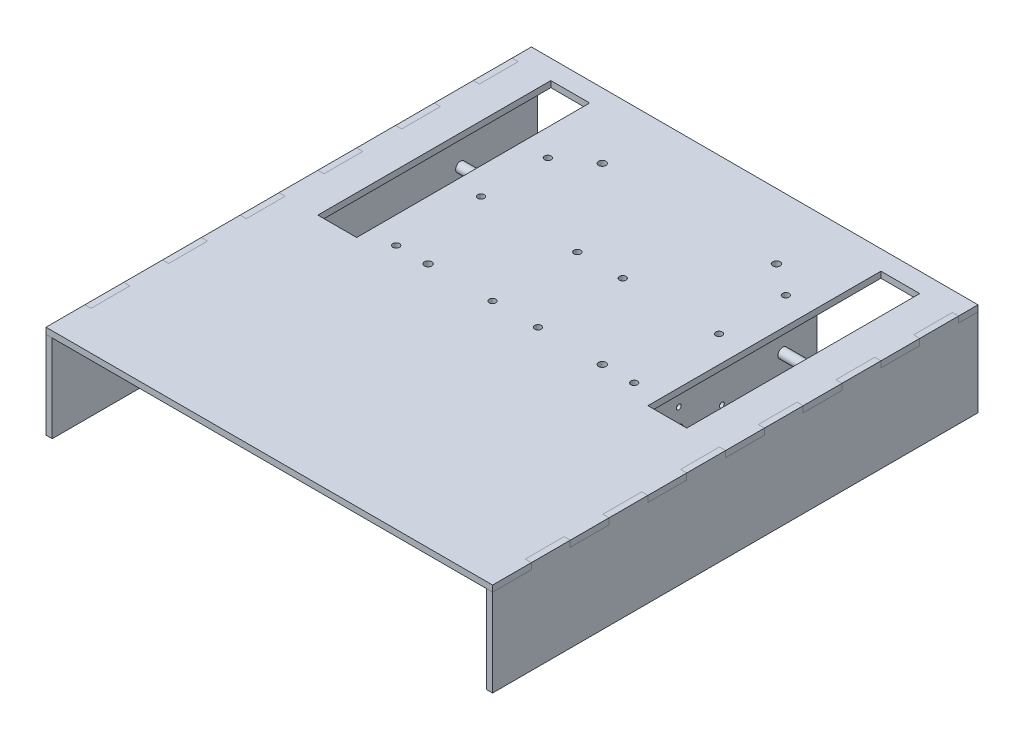
from build123d import *

# Parameters (mm, degrees)
SKETCH2_W           = 20
SKETCH2_H           = 120
BOSS_EXTRUDE1_DEPTH = 3.175
BOSS_EXTRUDE2_DEPTH = 3.175
BOSS_EXTRUDE3_DEPTH = 1.6129
SKETCH6_R           = 1.27
SKETCH6_R_2         = 2.3749
SKETCH6_R_3         = 2.55
BOSS_EXTRUDE4_DEPTH = 1.6129
SKETCH7_R           = 1.7
SKETCH7_R_2         = 1.9
CUT_EXTRUDE1_DEPTH  = 10
SKETCH9_R           = 2.5
BOSS_EXTRUDE6_DEPTH = 189


with BuildPart() as part:
    # Sketch2 → Boss-Extrude1 (new body)
    with BuildSketch(Plane(origin=(0, 0, 0), x_dir=(1, 0, 0), z_dir=(0, 1, 0))):
        Polygon((-172.266187111, -88.214102909), (57.733812889, -88.214102909), (57.733812889, -68.214102909), (54.558812889, -68.214102909), (54.558812889, -48.214102909), (57.733812889, -48.214102909), (57.733812889, -28.214102909), (54.558812889, -28.214102909), (54.558812889, -8.214102909), (57.733812889, -8.214102909), (57.733812889, 11.785897091), (54.558812889, 11.785897091), (54.558812889, 31.785897091), (57.733812889, 31.785897091), (57.733812889, 51.785897091), (54.558812889, 51.785897091), (54.558812889, 71.785897091), (57.733812889, 71.785897091), (57.733812889, 91.785897091), (54.558812889, 91.785897091), (54.558812889, 111.785897091), (57.733812889, 111.785897091), (57.733812889, 131.785897091), (54.558812889, 131.785897091), (54.558812889, 151.785897091), (57.733812889, 151.785897091), (57.733812889, 161.785897091), (-172.266187111, 161.785897091), (-172.266187111, 151.785897091), (-169.091187111, 151.785897091), (-169.091187111, 131.785897091), (-172.266187111, 131.785897091), (-172.266187111, 111.785897091), (-169.091187111, 111.785897091), (-169.091187111, 91.785897091), (-172.266187111, 91.785897091), (-172.266187111, 71.785897091), (-169.091187111, 71.785897091), (-169.091187111, 51.785897091), (-172.266187111, 51.785897091), (-172.266187111, 31.785897091), (-169.091187111, 31.785897091), (-169.091187111, 11.785897091), (-172.266187111, 11.785897091), (-172.266187111, -8.214102909), (-169.091187111, -8.214102909), (-169.091187111, -28.214102909), (-172.266187111, -28.214102909), (-172.266187111, -48.214102909), (-169.091187111, -48.214102909), (-169.091187111, -68.214102909), (-172.266187111, -68.214102909), align=None)
        with Locations((27.733812889, 91.785897091)):
            Rectangle(SKETCH2_W, SKETCH2_H, mode=Mode.SUBTRACT)
        with Locations((-142.266187111, 91.785897091)):
            Rectangle(SKETCH2_W, SKETCH2_H, mode=Mode.SUBTRACT)
    extrude(amount=BOSS_EXTRUDE1_DEPTH)


with BuildPart() as body_2:
    # Sketch3 → Boss-Extrude2 (new body)
    with BuildSketch(Plane.ZY.offset(169.091187111)):
        Polygon((68.214102909, 3.175), (68.214102909, 0), (88.214102909, 0), (88.214102909, -45), (-161.732040232, -45), (-161.732040232, 0), (-151.785897091, 0), (-151.785897091, 3.175), (-131.785897091, 3.175), (-131.785897091, 0), (-111.785897091, 0), (-111.785897091, 3.175), (-91.785897091, 3.175), (-91.785897091, 0), (-71.785897091, 0), (-71.785897091, 3.175), (-51.785897091, 3.175), (-51.785897091, 0), (-31.785897091, 0), (-31.785897091, 3.175), (-11.785897091, 3.175), (-11.785897091, 0), (8.214102909, 0), (8.214102909, 3.175), (28.214102909, 3.175), (28.214102909, 0), (48.214102909, 0), (48.214102909, 3.175), align=None)
    extrude(amount=BOSS_EXTRUDE2_DEPTH)


with BuildPart() as body_3:
    # Sketch4 → Boss-Extrude3 (new body)
    with BuildSketch(Plane.XZ):
        Polygon((-128.266187111, -122.812619878), (-128.266187111, -33.510319411), (-110.428738975, -33.510319411), (-110.428738975, -55.404375385), (-73.179527552, -55.404375385), (-73.179527552, -32.986733746), (-64.765041143, -32.986733746), (-64.765041143, -87.177277304), (-73.179527552, -87.177277304), (-73.179527552, -65.404375385), (-110.42560363, -65.404375385), (-110.42560363, -122.812619878), align=None)
    extrude(amount=BOSS_EXTRUDE3_DEPTH)

    # Sketch6 → Boss-Extrude4 (add)
    with BuildSketch(Plane(origin=(-128.266187111, 113.834921078, 0), x_dir=(0, -1, 0), z_dir=(1, 0, 0))):
        with BuildLine():
            Line((135.755040524, 122.812619878), (113.834921078, 122.812619878))
            Line((113.834921078, 122.812619878), (113.834921078, 33.510319411))
            Line((113.834921078, 33.510319411), (133.404101078, 33.510319411))
            ThreePointArc((133.404101078, 33.510319411), (151.380719154, 59.699448377), (135.755040524, 87.355685301))
            Line((135.755040524, 87.355685301), (135.755040524, 122.812619878))
        make_face()
        with Locations((123.193301078, 51.685825385)):
            Circle(SKETCH6_R, mode=Mode.SUBTRACT)
        with Locations((133.404101078, 51.685825385)):
            Circle(SKETCH6_R_2, mode=Mode.SUBTRACT)
        with Locations((143.614901078, 51.685825385)):
            Circle(SKETCH6_R, mode=Mode.SUBTRACT)
        with Locations((133.404101078, 73.860025385)):
            Circle(SKETCH6_R, mode=Mode.SUBTRACT)
        with Locations((125.834921078, 105.254818177)):
            Circle(SKETCH6_R_3, mode=Mode.SUBTRACT)
    extrude(amount=BOSS_EXTRUDE4_DEPTH)


with BuildPart() as cut_extrude1_tool:
    # Sketch7 → Cut-Extrude1 (new body)
    with BuildSketch(Plane.XZ.offset(1.6129)):
        with Locations((-118.541013043, -82.124992621)):
            Circle(SKETCH7_R)
        with Locations((-118.541013043, -38.429929163)):
            Circle(SKETCH7_R)
        with Locations((-68.972284348, -38.429929163)):
            Circle(SKETCH7_R)
        with Locations((-68.972284348, -82.124992621)):
            Circle(SKETCH7_R)
        with Locations((-118.541013043, -116.547553094)):
            Circle(SKETCH7_R)
        with Locations((-102.118387528, -38.429929163)):
            Circle(SKETCH7_R_2)
        with Locations((-102.118387528, -128.129929163)):
            Circle(SKETCH7_R_2)
    cut_extrude1 = extrude(amount=-CUT_EXTRUDE1_DEPTH)


with BuildPart() as part_1:
    add(part.part)

    # Cut-Extrude1: cut by cut_extrude1_tool
    add(cut_extrude1_tool.part, mode=Mode.SUBTRACT)

    # Mirror2: Cut-Extrude1 across plane
    add(cut_extrude1.mirror(Plane.ZY.offset(57.266187111)), mode=Mode.SUBTRACT)


with BuildPart() as body_3_1:
    add(body_3.part)

    # Cut-Extrude1: cut by cut_extrude1_tool
    add(cut_extrude1_tool.part, mode=Mode.SUBTRACT)


with BuildPart() as body_4:
    # Mirror1: mirrored copy
    add(body_3_1.part.mirror(Plane.ZY.offset(57.266187111)))


with BuildPart() as body_5:
    # Mirror1 2: mirrored copy
    add(body_2.part.mirror(Plane.ZY.offset(57.266187111)))


with BuildPart() as body_6:
    # Sketch9 → Boss-Extrude6 (new body)
    with BuildSketch(Plane(origin=(-152.266187111, 0, 0), x_dir=(0, 0, -1), z_dir=(1, 0, 0))):
        with Locations((105.254818177, -12)):
            Circle(SKETCH9_R)
    extrude(amount=BOSS_EXTRUDE6_DEPTH)


solid = Compound([body_2.part, part_1.part, body_3_1.part, body_4.part, body_5.part, body_6.part])
